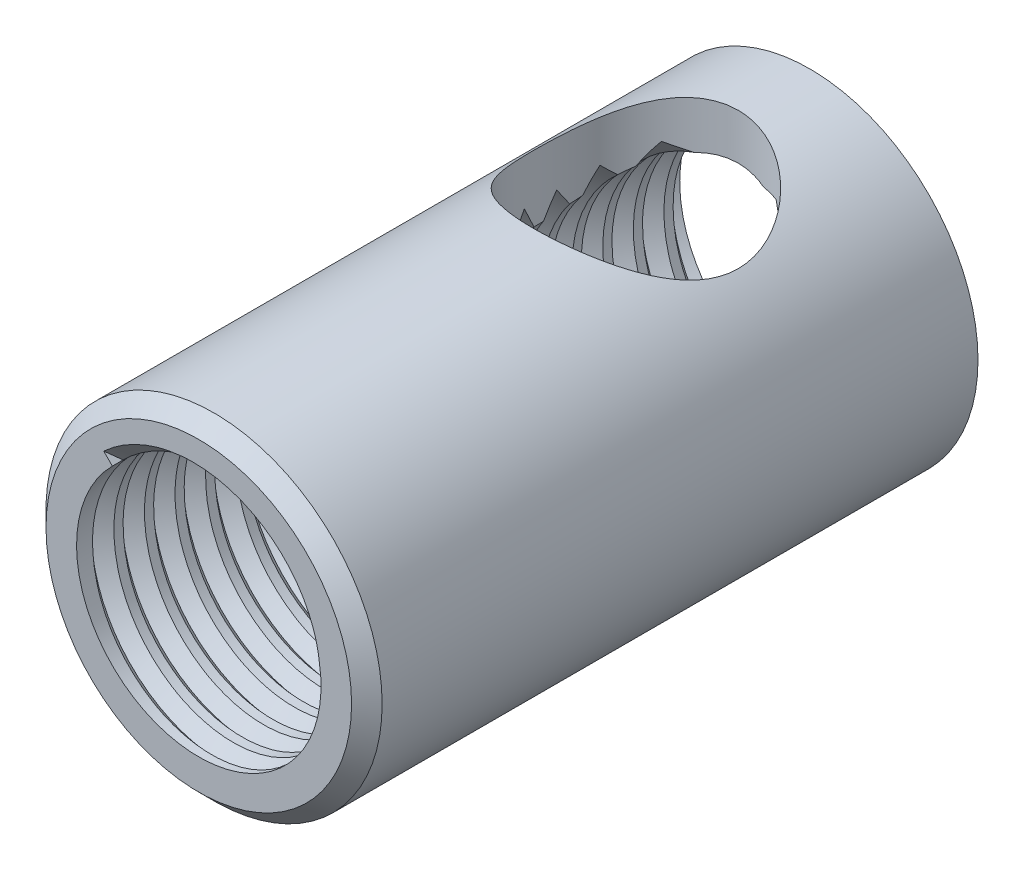
from build123d import *

# Parameters (mm, degrees)
SKETCH_1_R          = 5.5
EXTRUDE_1_DEPTH     = 20
CHAMFER_1_SIZE      = 0.5
SKETCH_2_R          = 4
CUT_EXTRUDE_1_DEPTH = 22.459263734
SWEEP_1_PITCH       = 1
SKETCH_5_R          = 3.35
CUT_EXTRUDE_2_DEPTH = 22.459263878
CUT_EXTRUDE_START   = 20
SKETCH_5_2_R        = 3.35
CUT_EXTRUDE_3_DEPTH = 20


with BuildPart() as part:
    # 草图1 → 凸台-拉伸1 (new body)
    with BuildSketch(Plane.XY):
        Circle(SKETCH_1_R)
    extrude(amount=EXTRUDE_1_DEPTH)

    # 倒角1
    chamfer_1_edges = [part.edges().sort_by_distance(p)[0] for p in [
        (-5.5, 0, 20),
    ]]
    chamfer(chamfer_1_edges, length=CHAMFER_1_SIZE)

    # 草图2 → 切除-拉伸1 (cut, through all)
    with BuildSketch(Plane.XY.offset(20)):
        Circle(SKETCH_2_R)
    extrude(amount=-CUT_EXTRUDE_1_DEPTH, mode=Mode.SUBTRACT)

    # 切除-扫描1: arcs per turn and ends read off the stored shape
    # 切除-扫描1: the profile of 草图4 profile screwed along a right-hand helix through 20 turns, 8 arcs to a turn; built about Z, then put on its axis
    sweep_1_z = Axis((0, 0, 0), (0, 0, 1))
    sweep_1_corners = [(3.9997, 0, 0.350262511), (3.9997, 0, -0.350262489), (4.4, 0, 1.1e-08)]
    with BuildLine(mode=Mode.PRIVATE) as sweep_1_profile:
        Line(sweep_1_corners[0], sweep_1_corners[1])
        Line(sweep_1_corners[1], sweep_1_corners[2])
        Line(sweep_1_corners[2], sweep_1_corners[0])
    sweep_1_cap = Face(sweep_1_profile.wire())
    sweep_1_turn_angles = [0, 22.5, 45, 67.5, 90, 112.5, 135, 157.5, 180, 202.5, 225, 247.5, 270, 292.5, 315, 337.5, 360]
    sweep_1_turn_weights = [1, 0.9238795325112867, 1, 0.9238795325112867, 1, 0.9238795325112867, 1, 0.9238795325112867, 1, 0.9238795325112867, 1, 0.9238795325112867, 1, 0.9238795325112867, 1, 0.9238795325112867, 1]
    sweep_1_turn_rails = [Edge.make_bspline([Vector(p[0], p[1], 0).rotate(sweep_1_z, sweep_1_turn_angles[k]) / sweep_1_turn_weights[k] + Vector(0, 0, p[2] + SWEEP_1_PITCH * sweep_1_turn_angles[k] / 360) for k in range(17)], [0, 0, 0, 1, 1, 2, 2, 3, 3, 4, 4, 5, 5, 6, 6, 7, 7, 8, 8, 8], 2, sweep_1_turn_weights) for p in sweep_1_corners]
    sweep_1_turn_sides = [Face.make_surface_from_curves(sweep_1_turn_rails[p[0]], sweep_1_turn_rails[p[1]]) for p in [(0, 1), (1, 2), (2, 0)]]
    sweep_1 = Plane(origin=(0, 0, 20), x_dir=(-0.7071067811865512, 0.7071067811865438, 0), z_dir=(0, 0, -1)) * Solid(Shell([*[p.moved(Location((0, 0, SWEEP_1_PITCH * i))) for i in range(20) for p in sweep_1_turn_sides], sweep_1_cap, sweep_1_cap.rotate(sweep_1_z, 7200).moved(Location((0, 0, SWEEP_1_PITCH * 7200 / 360)))]))
    add(sweep_1, mode=Mode.SUBTRACT)

    # 草图5 → 切除-拉伸2 (cut, through all)
    with BuildSketch(Plane(origin=(0, 0, 0), x_dir=(1, 0, 0), z_dir=(0, 1, 0))):
        with Locations(Location((0, -5.695246639, 0), (0, 0, 270))):
            Circle(SKETCH_5_R)
    extrude(amount=-CUT_EXTRUDE_2_DEPTH, mode=Mode.SUBTRACT)

    # 草图5<2> → 切除-拉伸3 (cut)
    with BuildSketch(Plane(origin=(0, 0, 0), x_dir=(1, 0, 0), z_dir=(0, 1, 0)).offset(CUT_EXTRUDE_START)):
        with Locations(Location((0, -5.695246639, 0), (0, 0, 270))):
            Circle(SKETCH_5_2_R)
    extrude(amount=-CUT_EXTRUDE_3_DEPTH, mode=Mode.SUBTRACT)


solid = part.part
